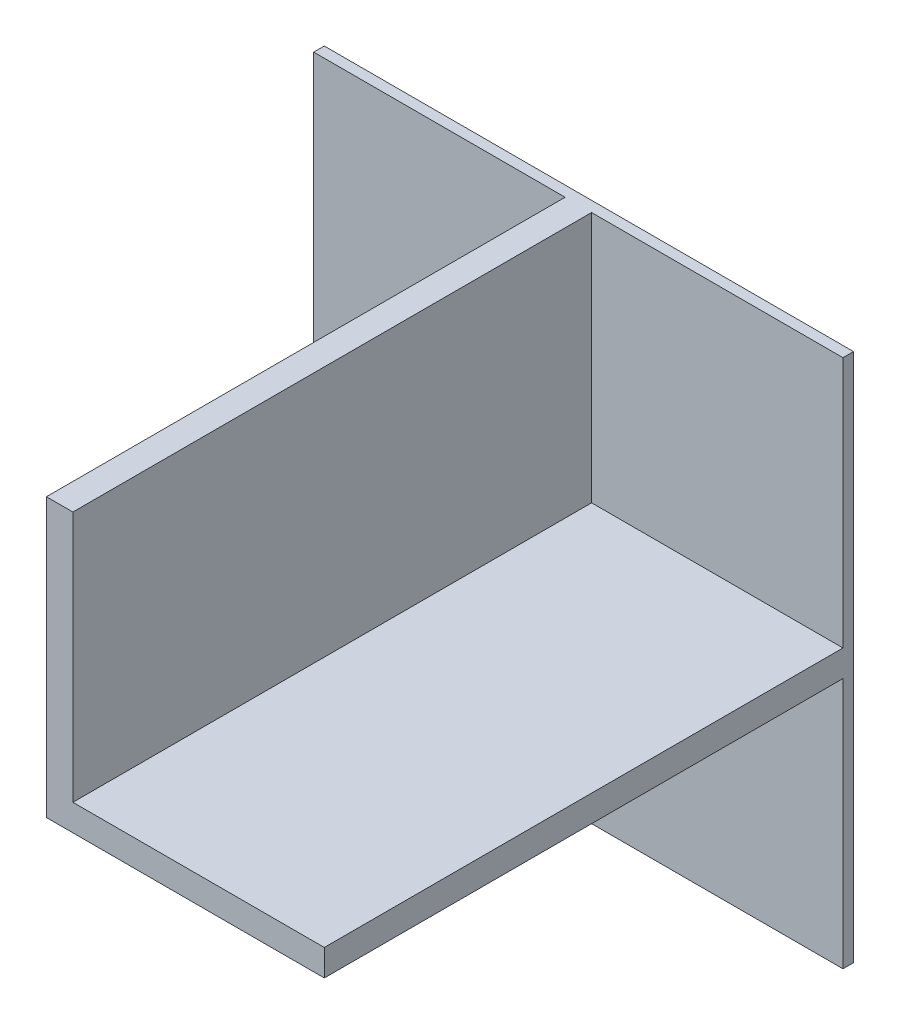
from build123d import *

# Parameters (mm, degrees)
SZKIC1_W                    = 200
SZKIC1_H                    = 200
DODANIE_WYCI_GNI_CIE1_DEPTH = 4
DODANIE_WYCI_GNI_CIE3_DEPTH = 196


with BuildPart() as part:
    # Szkic1 → Dodanie-wyciągnięcie1 (new body)
    with BuildSketch(Plane.XY):
        Rectangle(SZKIC1_W, SZKIC1_H)
    extrude(amount=DODANIE_WYCI_GNI_CIE1_DEPTH)

    # Szkic2 → Dodanie-wyciągnięcie3 (add)
    with BuildSketch(Plane.XY.offset(4)):
        Polygon((5, 100), (-5, 100), (-5, -5), (100, -5), (100, 5), (5, 5), align=None)
    extrude(amount=DODANIE_WYCI_GNI_CIE3_DEPTH)


solid = part.part
